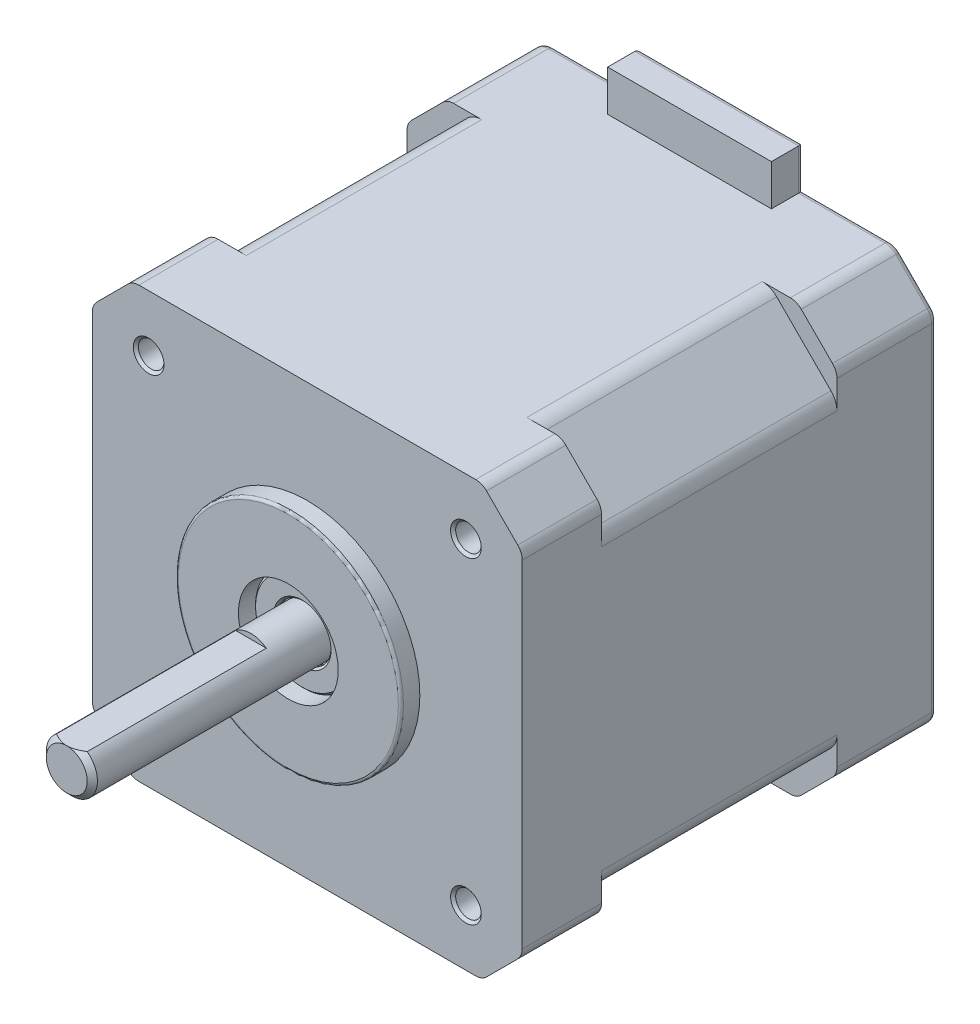
from build123d import *

# Parameters (mm, degrees)
SKETCH_1_W          = 42
SKETCH_1_H          = 42
EXTRUDE_1_DEPTH     = 40.5
SKETCH_2_W          = 16
SKETCH_2_H          = 4
EXTRUDE_2_DEPTH     = 3.15
CUT_EXTRUDE_1_REACH = 54.022
CUT_EXTRUDE_START   = -9.75
CUT_EXTRUDE_2_DEPTH = 23
SKETCH_5_R          = 11
SKETCH_5_R_2        = 4.875
EXTRUDE_4_DEPTH     = 1.85
SKETCH_6_R          = 4.75
SKETCH_6_R_2        = 2.625
EXTRUDE_5_DEPTH     = 0.5
CHAMFER_1_SIZE      = 0.2
SKETCH_7_R          = 2.5
EXTRUDE_6_DEPTH     = 23.5
SKETCH_8_R          = 1.25
CUT_EXTRUDE_3_DEPTH = 4
CHAMFER_2_SIZE      = 0.25
CUT_EXTRUDE_START_2 = -18
CUT_EXTRUDE_4_DEPTH = 18
CHAMFER_3_SIZE      = 0.5
FILLET_1_R          = 0.25
FILLET_2_R          = 1.5
FILLET_3_R          = 2
FILLET_4_R          = 0.5


with BuildPart() as part:
    # 草图1 → 凸台-拉伸1 (new body)
    with BuildSketch(Plane.XY):
        Rectangle(SKETCH_1_W, SKETCH_1_H)
    extrude(amount=EXTRUDE_1_DEPTH)

    # 草图2 → 凸台-拉伸2 (add)
    with BuildSketch(Plane(origin=(0, 0, 0), x_dir=(-1, 0, 0), z_dir=(0, 0, -1))):
        with Locations((0, 23)):
            Rectangle(SKETCH_2_W, SKETCH_2_H)
    extrude(amount=-EXTRUDE_2_DEPTH)

    # 草图3 → 切除-拉伸1 (cut, up to next)
    with BuildSketch(Plane(origin=(0, 0, 0), x_dir=(-1, 0, 0), z_dir=(0, 0, -1)), mode=Mode.PRIVATE) as cut_extrude_1_sk1:
        Polygon((-17.075, 21), (-21, 17.075), (-21, 21), align=None)
    cut_extrude_1_tool1 = extrude(cut_extrude_1_sk1.sketch, amount=-CUT_EXTRUDE_1_REACH, mode=Mode.PRIVATE) & part.part
    # 草图3 → 切除-拉伸1 (cut, up to next)
    with BuildSketch(Plane(origin=(0, 0, 0), x_dir=(-1, 0, 0), z_dir=(0, 0, -1)), mode=Mode.PRIVATE) as cut_extrude_1_sk2:
        Polygon((17.075, 21), (21, 17.075), (21, 21), align=None)
    cut_extrude_1_tool2 = extrude(cut_extrude_1_sk2.sketch, amount=-CUT_EXTRUDE_1_REACH, mode=Mode.PRIVATE) & part.part
    # 草图3 → 切除-拉伸1 (cut, up to next)
    with BuildSketch(Plane(origin=(0, 0, 0), x_dir=(-1, 0, 0), z_dir=(0, 0, -1)), mode=Mode.PRIVATE) as cut_extrude_1_sk3:
        Polygon((21, -17.075), (17.075, -21), (21, -21), align=None)
    cut_extrude_1_tool3 = extrude(cut_extrude_1_sk3.sketch, amount=-CUT_EXTRUDE_1_REACH, mode=Mode.PRIVATE) & part.part
    # 草图3 → 切除-拉伸1 (cut, up to next)
    with BuildSketch(Plane(origin=(0, 0, 0), x_dir=(-1, 0, 0), z_dir=(0, 0, -1)), mode=Mode.PRIVATE) as cut_extrude_1_sk4:
        Polygon((-21, -17.075), (-17.075, -21), (-21, -21), align=None)
    cut_extrude_1_tool4 = extrude(cut_extrude_1_sk4.sketch, amount=-CUT_EXTRUDE_1_REACH, mode=Mode.PRIVATE) & part.part
    add(cut_extrude_1_tool1.solids().sort_by_distance((19.691667, 19.691667, 0))[0], mode=Mode.SUBTRACT)
    add(cut_extrude_1_tool2.solids().sort_by_distance((-19.691667, 19.691667, 0))[0], mode=Mode.SUBTRACT)
    add(cut_extrude_1_tool3.solids().sort_by_distance((-19.691667, -19.691667, 0))[0], mode=Mode.SUBTRACT)
    add(cut_extrude_1_tool4.solids().sort_by_distance((19.691667, -19.691667, 0))[0], mode=Mode.SUBTRACT)

    # 草图4 → 切除-拉伸2 (cut)
    with BuildSketch(Plane(origin=(0, 0, 0), x_dir=(-1, 0, 0), z_dir=(0, 0, -1)).offset(CUT_EXTRUDE_START)):
        Polygon((-21, 14.532), (-14.532, 21), (-21, 21), align=None)
        Polygon((14.532, 21), (21, 14.532), (21, 21), align=None)
        Polygon((21, -14.532), (14.532, -21), (21, -21), align=None)
        Polygon((-14.532, -21), (-21, -14.532), (-21, -21), align=None)
    extrude(amount=-CUT_EXTRUDE_2_DEPTH, mode=Mode.SUBTRACT)

    # 草图5 → 凸台-拉伸4 (add)
    with BuildSketch(Plane.XY.offset(40.5)):
        Circle(SKETCH_5_R)
        Circle(SKETCH_5_R_2, mode=Mode.SUBTRACT)
    extrude(amount=EXTRUDE_4_DEPTH)

    # 草图6 → 凸台-拉伸5 (add)
    with BuildSketch(Plane.XY.offset(40.5)):
        Circle(SKETCH_6_R)
        Circle(SKETCH_6_R_2, mode=Mode.SUBTRACT)
    extrude(amount=EXTRUDE_5_DEPTH)

    # 倒角1
    chamfer_1_edges = [part.edges().sort_by_distance(p)[0] for p in [
        (-4.75, 0, 41),
        (-2.625, 0, 41),
    ]]
    chamfer(chamfer_1_edges, length=CHAMFER_1_SIZE)

    # 草图7 → 凸台-拉伸6 (add)
    with BuildSketch(Plane.XY.offset(40.5)):
        Circle(SKETCH_7_R)
    extrude(amount=EXTRUDE_6_DEPTH)

    # 草图8 → 切除-拉伸3 (cut)
    with BuildSketch(Plane.XY.offset(40.5)):
        with Locations((-15.5, 15.5)):
            Circle(SKETCH_8_R)
        with Locations((15.5, 15.5)):
            Circle(SKETCH_8_R)
        with Locations((15.5, -15.5)):
            Circle(SKETCH_8_R)
        with Locations((-15.5, -15.5)):
            Circle(SKETCH_8_R)
    extrude(amount=-CUT_EXTRUDE_3_DEPTH, mode=Mode.SUBTRACT)

    # 倒角2
    chamfer_2_edges = [part.edges().sort_by_distance(p)[0] for p in [
        (-16.75, -15.5, 40.5),
        (14.25, -15.5, 40.5),
        (14.25, 15.5, 40.5),
        (-16.75, 15.5, 40.5),
    ]]
    chamfer(chamfer_2_edges, length=CHAMFER_2_SIZE)

    # 草图9 → 切除-拉伸4 (cut)
    with BuildSketch(Plane.XY.offset(64).offset(CUT_EXTRUDE_START_2)):
        with BuildLine():
            Line((-1.5, 2), (1.5, 2))
            ThreePointArc((1.5, 2), (0, 2.5), (-1.5, 2))
        make_face()
    extrude(amount=CUT_EXTRUDE_4_DEPTH, mode=Mode.SUBTRACT)

    # 倒角3
    chamfer_3_edges = [part.edges().sort_by_distance(p)[0] for p in [
        (-1.118033989, -2.236067977, 64),
    ]]
    chamfer(chamfer_3_edges, length=CHAMFER_3_SIZE - 0.0001)  # a hair under: the kernel refuses the full size

    # 圆角1
    fillet_1_edges = [part.edges().sort_by_distance(p)[0] for p in [
        (-11, 0, 42.35),
    ]]
    fillet(fillet_1_edges, radius=FILLET_1_R)

    # 圆角2
    fillet_2_edges = [part.edges().sort_by_distance(p)[0] for p in [
        (21, -17.075, 36.625),
        (17.075, -21, 36.625),
        (-21, -17.075, 36.625),
        (-17.075, -21, 36.625),
        (-17.075, 21, 36.625),
        (-21, 17.075, 36.625),
        (17.075, 21, 36.625),
        (21, 17.075, 36.625),
        (17.075, -21, 4.875),
        (21, -17.075, 4.875),
        (-21, -17.075, 4.875),
        (-17.075, -21, 4.875),
        (-17.075, 21, 4.875),
        (-21, 17.075, 4.875),
        (21, 17.075, 4.875),
        (17.075, 21, 4.875),
    ]]
    fillet(fillet_2_edges, radius=FILLET_2_R)

    # 圆角3
    fillet_3_edges = [part.edges().sort_by_distance(p)[0] for p in [
        (-21, -14.532, 21.25),
        (-14.532, -21, 21.25),
        (-14.532, 21, 21.25),
        (-21, 14.532, 21.25),
        (21, 14.532, 21.25),
        (14.532, 21, 21.25),
        (14.532, -21, 21.25),
        (21, -14.532, 21.25),
    ]]
    fillet(fillet_3_edges, radius=FILLET_3_R)

    # 圆角4
    fillet_4_edges = [part.edges().sort_by_distance(p)[0] for p in [
        (-12.226839828, 21, 0),
        (-8, 23, 0),
        (0, 25, 0),
        (8, 23, 0),
        (-21, 0, 0),
        (0, -21, 0),
        (21, 0, 0),
        (19.0375, -19.0375, 0),
        (-19.0375, -19.0375, 0),
        (-19.0375, 19.0375, 0),
        (12.226839828, 21, 0),
        (19.0375, 19.0375, 0),
        (17.027704805, 20.885819299, 0),
        (20.885819299, 17.027704805, 0),
        (20.885819299, -17.027704805, 0),
        (17.027704805, -20.885819299, 0),
        (-20.885819299, 17.027704805, 0),
        (-17.027704805, 20.885819299, 0),
        (-20.885819299, -17.027704805, 0),
        (-17.027704805, -20.885819299, 0),
    ]]
    fillet(fillet_4_edges, radius=FILLET_4_R)


solid = part.part
